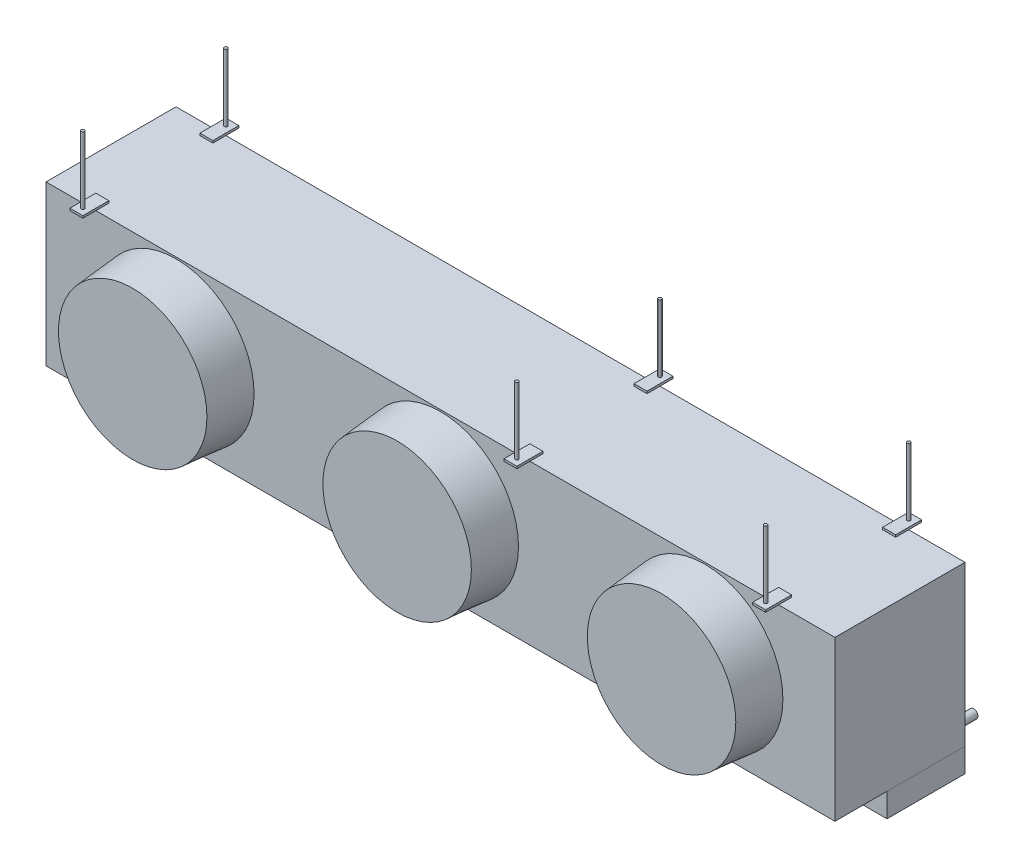
from build123d import *

# Parameters (mm, degrees)
SKETCH1_W                     = 2311.4
SKETCH1_H                     = 381
BOSS_EXTRUDE1_DEPTH           = 466.725
SKETCH2_R                     = 228.6
BOSS_EXTRUDE2_DEPTH           = 127
BOSS_EXTRUDE2_DRAFT           = 5
BOSS_EXTRUDE2_PROFILE_2_DEPTH = 127
BOSS_EXTRUDE2_PROFILE_2_DRAFT = 5
BOSS_EXTRUDE2_PROFILE_3_DEPTH = 127
BOSS_EXTRUDE2_PROFILE_3_DRAFT = 5
SKETCH3_W                     = 38.1
SKETCH3_H                     = 76.2
SKETCH3_R                     = 4.7625
BOSS_EXTRUDE3_DEPTH           = 6.35
SKETCH4_R                     = 4.7625
BOSS_EXTRUDE4_DEPTH           = 203.2
BOSS_EXTRUDE4_2_DEPTH         = 203.2
BOSS_EXTRUDE4_3_DEPTH         = 203.2
BOSS_EXTRUDE4_4_DEPTH         = 203.2
BOSS_EXTRUDE4_5_DEPTH         = 203.2
BOSS_EXTRUDE4_6_DEPTH         = 203.2
SKETCH5_W                     = 2311.4
SKETCH5_H                     = 228.6
BOSS_EXTRUDE5_DEPTH           = 69.85
SKETCH6_R                     = 12.7
SKETCH6_R_2                   = 11.1125
BOSS_EXTRUDE6_DEPTH           = 44.45
SKETCH7_R                     = 12.7
BOSS_EXTRUDE7_DEPTH           = 76.2


with BuildPart() as part:
    # Sketch1 → Boss-Extrude1 (new body)
    with BuildSketch(Plane(origin=(0, 0, 0), x_dir=(1, 0, 0), z_dir=(0, 1, 0))):
        Rectangle(SKETCH1_W, SKETCH1_H)
    extrude(amount=BOSS_EXTRUDE1_DEPTH)


with BuildPart() as boss_extrude2_tool:
    # Sketch2 → Boss-Extrude2 (with draft: the straight prism first)
    with BuildSketch(Plane.XY.offset(190.5)):
        with Locations((0, 233.3625)):
            Circle(SKETCH2_R)
    extrude(amount=BOSS_EXTRUDE2_DEPTH)
    # Boss-Extrude2: the draft: its side faces are tilted about the plane it starts from
    boss_extrude2_sides = [boss_extrude2_tool.faces().sort_by_distance(p)[0] for p in [
        (-228.6, 233.3625, 254),
    ]]
    draft(boss_extrude2_sides, Plane.XY.offset(190.5), BOSS_EXTRUDE2_DRAFT)


with BuildPart() as part_1:
    add(part.part)

    # Boss-Extrude2: add boss_extrude2_tool
    add(boss_extrude2_tool.part)


with BuildPart() as boss_extrude2_profile_2_tool:
    # Sketch2 → Boss-Extrude2 profile 2 (with draft: the straight prism first)
    with BuildSketch(Plane.XY.offset(190.5)):
        with Locations((774.7, 233.3625)):
            Circle(SKETCH2_R)
    extrude(amount=BOSS_EXTRUDE2_PROFILE_2_DEPTH)
    # Boss-Extrude2 profile 2: the draft: its side faces are tilted about the plane it starts from
    boss_extrude2_profile_2_sides = [boss_extrude2_profile_2_tool.faces().sort_by_distance(p)[0] for p in [
        (546.1, 233.3625, 254),
    ]]
    draft(boss_extrude2_profile_2_sides, Plane.XY.offset(190.5), BOSS_EXTRUDE2_PROFILE_2_DRAFT)


with BuildPart() as part_2:
    add(part_1.part)

    # Boss-Extrude2 profile 2: add boss_extrude2_profile_2_tool
    add(boss_extrude2_profile_2_tool.part)


with BuildPart() as boss_extrude2_profile_3_tool:
    # Sketch2 → Boss-Extrude2 profile 3 (with draft: the straight prism first)
    with BuildSketch(Plane.XY.offset(190.5)):
        with Locations((-774.7, 233.3625)):
            Circle(SKETCH2_R)
    extrude(amount=BOSS_EXTRUDE2_PROFILE_3_DEPTH)
    # Boss-Extrude2 profile 3: the draft: its side faces are tilted about the plane it starts from
    boss_extrude2_profile_3_sides = [boss_extrude2_profile_3_tool.faces().sort_by_distance(p)[0] for p in [
        (-1003.3, 233.3625, 254),
    ]]
    draft(boss_extrude2_profile_3_sides, Plane.XY.offset(190.5), BOSS_EXTRUDE2_PROFILE_3_DRAFT)


with BuildPart() as part_3:
    add(part_2.part)

    # Boss-Extrude2 profile 3: add boss_extrude2_profile_3_tool
    add(boss_extrude2_profile_3_tool.part)

    # Sketch3 → Boss-Extrude3 (add)
    # profile 1 of 6: a face of its own
    with BuildSketch(Plane(origin=(0, 466.725, 0), x_dir=(1, 0, 0), z_dir=(0, 1, 0))):
        with Locations((242.9637, 190.5)):
            Rectangle(SKETCH3_W, SKETCH3_H)
        with Locations((242.9637, 209.55)):
            Circle(SKETCH3_R, mode=Mode.SUBTRACT)
    # profile 2 of 6: a face of its own
    with BuildSketch(Plane(origin=(0, 466.725, 0), x_dir=(1, 0, 0), z_dir=(0, 1, 0))):
        with Locations((242.9637, -190.5)):
            Rectangle(SKETCH3_W, SKETCH3_H)
        with Locations((242.9637, -209.55)):
            Circle(SKETCH3_R, mode=Mode.SUBTRACT)
    # profile 3 of 6: a face of its own
    with BuildSketch(Plane(origin=(0, 466.725, 0), x_dir=(1, 0, 0), z_dir=(0, 1, 0))):
        with Locations((971.55, 190.5)):
            Rectangle(SKETCH3_W, SKETCH3_H)
        with Locations((971.55, 209.55)):
            Circle(SKETCH3_R, mode=Mode.SUBTRACT)
    # profile 4 of 6: a face of its own
    with BuildSketch(Plane(origin=(0, 466.725, 0), x_dir=(1, 0, 0), z_dir=(0, 1, 0))):
        with Locations((971.55, -190.5)):
            Rectangle(SKETCH3_W, SKETCH3_H)
        with Locations((971.55, -209.55)):
            Circle(SKETCH3_R, mode=Mode.SUBTRACT)
    # profile 5 of 6: a face of its own
    with BuildSketch(Plane(origin=(0, 466.725, 0), x_dir=(1, 0, 0), z_dir=(0, 1, 0))):
        with Locations((-1028.7, 190.5)):
            Rectangle(SKETCH3_W, SKETCH3_H)
        with Locations((-1028.7, 209.55)):
            Circle(SKETCH3_R, mode=Mode.SUBTRACT)
    # profile 6 of 6: a face of its own
    with BuildSketch(Plane(origin=(0, 466.725, 0), x_dir=(1, 0, 0), z_dir=(0, 1, 0))):
        with Locations((-1028.7, -190.5)):
            Rectangle(SKETCH3_W, SKETCH3_H)
        with Locations((-1028.7, -209.55)):
            Circle(SKETCH3_R, mode=Mode.SUBTRACT)
    extrude(amount=BOSS_EXTRUDE3_DEPTH)

    # Sketch7 → Boss-Extrude7 (add)
    with BuildSketch(Plane(origin=(0, 0, -190.5), x_dir=(-1, 0, 0), z_dir=(0, 0, -1))):
        with Locations((-1104.9, 19.05)):
            Circle(SKETCH7_R)
        with Locations((1104.9, 19.05)):
            Circle(SKETCH7_R)
    extrude(amount=BOSS_EXTRUDE7_DEPTH)


with BuildPart() as body_2:
    # Sketch4 → Boss-Extrude4 (new body)
    with BuildSketch(Plane(origin=(0, 466.725, 0), x_dir=(1, 0, 0), z_dir=(0, 1, 0))):
        with Locations((-1028.7, 209.55)):
            Circle(SKETCH4_R)
    extrude(amount=BOSS_EXTRUDE4_DEPTH)


with BuildPart() as body_3:
    # Sketch4 → Boss-Extrude4 2 (new body)
    with BuildSketch(Plane(origin=(0, 466.725, 0), x_dir=(1, 0, 0), z_dir=(0, 1, 0))):
        with Locations((-1028.7, -209.55)):
            Circle(SKETCH4_R)
    extrude(amount=BOSS_EXTRUDE4_2_DEPTH)


with BuildPart() as body_4:
    # Sketch4 → Boss-Extrude4 3 (new body)
    with BuildSketch(Plane(origin=(0, 466.725, 0), x_dir=(1, 0, 0), z_dir=(0, 1, 0))):
        with Locations((242.9637, -209.55)):
            Circle(SKETCH4_R)
    extrude(amount=BOSS_EXTRUDE4_3_DEPTH)


with BuildPart() as body_5:
    # Sketch4 → Boss-Extrude4 4 (new body)
    with BuildSketch(Plane(origin=(0, 466.725, 0), x_dir=(1, 0, 0), z_dir=(0, 1, 0))):
        with Locations((242.9637, 209.55)):
            Circle(SKETCH4_R)
    extrude(amount=BOSS_EXTRUDE4_4_DEPTH)


with BuildPart() as body_6:
    # Sketch4 → Boss-Extrude4 5 (new body)
    with BuildSketch(Plane(origin=(0, 466.725, 0), x_dir=(1, 0, 0), z_dir=(0, 1, 0))):
        with Locations((971.55, 209.55)):
            Circle(SKETCH4_R)
    extrude(amount=BOSS_EXTRUDE4_5_DEPTH)


with BuildPart() as body_7:
    # Sketch4 → Boss-Extrude4 6 (new body)
    with BuildSketch(Plane(origin=(0, 466.725, 0), x_dir=(1, 0, 0), z_dir=(0, 1, 0))):
        with Locations((971.55, -209.55)):
            Circle(SKETCH4_R)
    extrude(amount=BOSS_EXTRUDE4_6_DEPTH)


with BuildPart() as body_8:
    # Sketch5 → Boss-Extrude5 (new body)
    with BuildSketch(Plane.XZ):
        with Locations((0, -76.2)):
            Rectangle(SKETCH5_W, SKETCH5_H)
    extrude(amount=BOSS_EXTRUDE5_DEPTH)

    # Sketch6 → Boss-Extrude6 (add)
    with BuildSketch(Plane.XZ.offset(69.85)):
        with Locations((0, -76.2)):
            Circle(SKETCH6_R)
        with Locations((0, -76.2)):
            Circle(SKETCH6_R_2, mode=Mode.SUBTRACT)
    extrude(amount=BOSS_EXTRUDE6_DEPTH)


solid = Compound([part_3.part, body_2.part, body_3.part, body_4.part, body_5.part, body_6.part, body_7.part, body_8.part])
